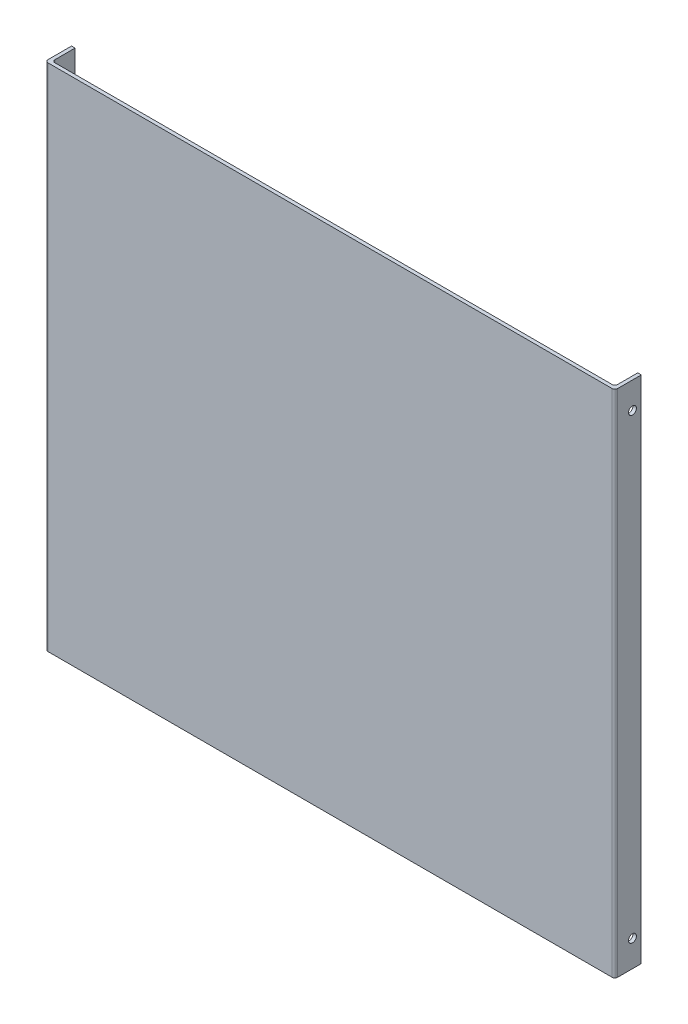
from build123d import *

# Parameters (mm, degrees)
ESQUISSE1_W           = 320
ESQUISSE1_H           = 290
BOSS_EXTRU_1_DEPTH    = 2
ESQUISSE2_W           = 15
ESQUISSE2_H           = 290
BOSS_EXTRU_2_DEPTH    = 2
CONG_1_R              = 1.5
CONG_1_OF_SYM_TRIE1_R = 1.5
D_GAGEMENT_M41_D      = 4.5


with BuildPart() as part:
    # Esquisse1 → Boss.-Extru.1 (new body)
    with BuildSketch(Plane.XY):
        Rectangle(ESQUISSE1_W, ESQUISSE1_H)
    extrude(amount=BOSS_EXTRU_1_DEPTH)

    # Esquisse2 → Boss.-Extru.2 (add)
    with BuildSketch(Plane.ZY.offset(160)):
        with Locations((-5.5, 0)):
            Rectangle(ESQUISSE2_W, ESQUISSE2_H)
    boss_extru_2 = extrude(amount=BOSS_EXTRU_2_DEPTH)

    # Congé1
    cong_1_edges = [part.edges().sort_by_distance(p)[0] for p in [
        (-160, 0, 0),
        (-162, 0, 2),
    ]]
    fillet(cong_1_edges, radius=CONG_1_R)

    # Symétrie1: Boss.-Extru.2 across plane
    add(boss_extru_2.mirror(Plane(origin=(0, 0, 0), x_dir=(0, 0, 1), z_dir=(1, 0, 0))))

    # Congé1 of Symétrie1
    cong_1_of_sym_trie1_edges = [part.edges().sort_by_distance(p)[0] for p in [
        (160, 0, 0),
        (162, 0, 2),
    ]]
    fillet(cong_1_of_sym_trie1_edges, radius=CONG_1_OF_SYM_TRIE1_R)

    # Dégagement M41 (through all)
    with Locations(Plane.ZY.offset(162)):
        with Locations((-8, -130), (-8, 130)):
            Hole(D_GAGEMENT_M41_D / 2)


solid = part.part
